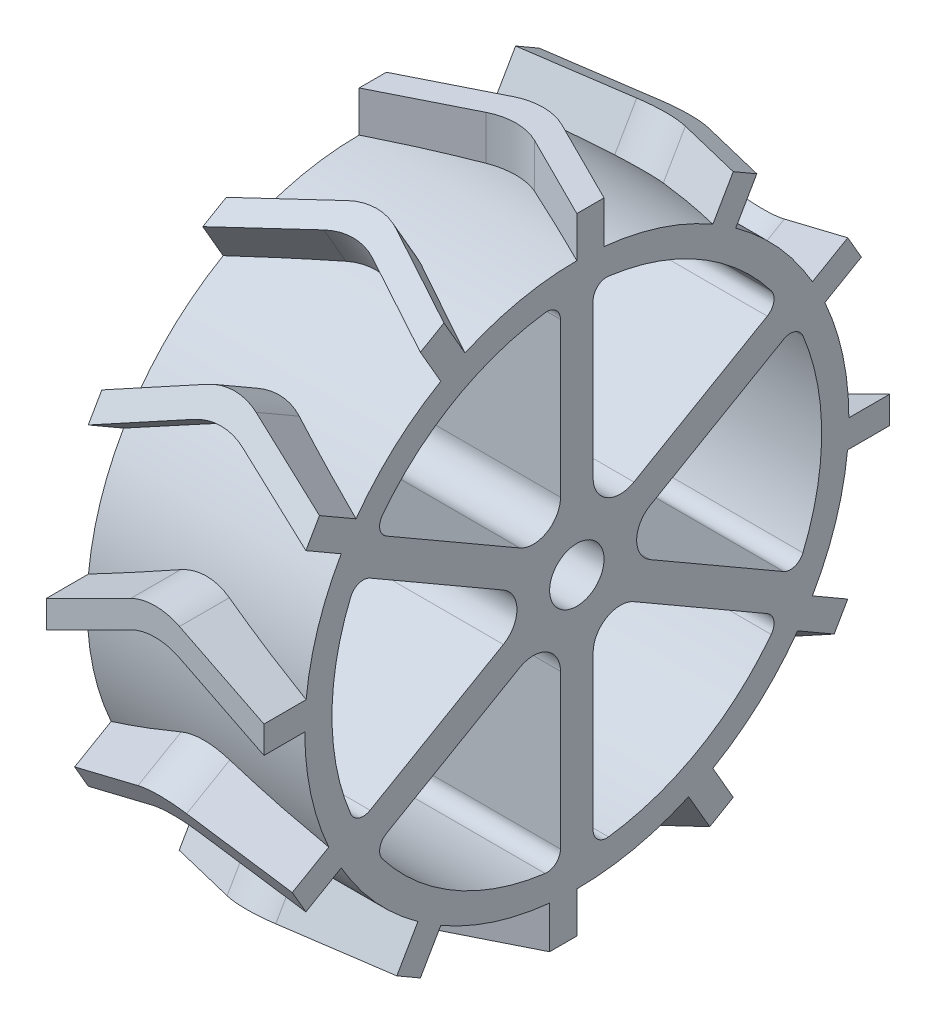
from build123d import *

# Parameters (mm, degrees)
SKETCH2_R                = 50
BOSS_EXTRUDE1_DEPTH      = 40
BOSS_EXTRUDE2_DEPTH      = 57.5
CIRPATTERN2_COUNT        = 12
CUT_EXTRUDE3_REACH       = 92.623
CUT_EXTRUDE4_REACH       = 92.623
SKETCH6_R                = 5
FILLET1_R                = 5
CIRPATTERN3_COUNT        = 6
FILLET1_OF_CIRPATTERN3_R = 5


with BuildPart() as part:
    # Sketch2 → Boss-Extrude1 (new body)
    with BuildSketch(Plane(origin=(0, 0, 0), x_dir=(0, 0, -1), z_dir=(1, 0, 0))):
        Circle(SKETCH2_R)
    extrude(amount=BOSS_EXTRUDE1_DEPTH)

    # Sketch4 → Boss-Extrude2 (add)
    with BuildSketch(Plane(origin=(0, 0, 0), x_dir=(1, 0, 0), z_dir=(0, 1, 0))):
        with BuildLine():
            Line((0, 0), (15.527864045, 7.763932023))
            ThreePointArc((15.527864045, 7.763932023), (20, 8.819660113), (24.472135955, 7.763932023))
            Line((24.472135955, 7.763932023), (40, 0))
            Line((40, 0), (40, 5))
            Line((40, 5), (24.472135955, 12.763932023))
            ThreePointArc((24.472135955, 12.763932023), (20, 13.819660113), (15.527864045, 12.763932023))
            Line((15.527864045, 12.763932023), (0, 5))
            Line((0, 5), (0, 0))
        make_face()
    boss_extrude2 = extrude(amount=BOSS_EXTRUDE2_DEPTH)

    # CirPattern2: Boss-Extrude2 ×12 about axis
    cirpattern2_axis = Axis((40, 0, 0), (-1, 0, 0))
    for i in range(1, CIRPATTERN2_COUNT):
        add(boss_extrude2.rotate(cirpattern2_axis, i * 360 / CIRPATTERN2_COUNT))

    # Sketch5 → Cut-Extrude3 (cut, up to next)
    with BuildSketch(Plane.ZY, mode=Mode.PRIVATE) as cut_extrude3_sk1:
        with BuildLine():
            Line((3, 42.142615011), (3, 5.196152423))
            Line((3, 5.196152423), (34.996575182, 23.669383717))
            ThreePointArc((34.996575182, 23.669383717), (36.198263903, 25.345343543), (35.73166784, 27.354120593))
            ThreePointArc((35.73166784, 27.354120593), (22.5, 38.97114317), (5.823529412, 44.621592365))
            ThreePointArc((5.823529412, 44.621592365), (3.850579424, 44.021287885), (3, 42.142615011))
        make_face()
    cut_extrude3_tool1 = extrude(cut_extrude3_sk1.sketch, amount=-CUT_EXTRUDE3_REACH, mode=Mode.PRIVATE) & part.part
    cut_extrude3 = cut_extrude3_tool1.solids().sort_by_distance((0, 26.780603, 15.461788))[0]
    add(cut_extrude3, mode=Mode.SUBTRACT)

    # Sketch6 → Cut-Extrude4 (cut, up to next)
    with BuildSketch(Plane.ZY, mode=Mode.PRIVATE) as cut_extrude4_sk1:
        Circle(SKETCH6_R)
    cut_extrude4_tool1 = extrude(cut_extrude4_sk1.sketch, amount=-CUT_EXTRUDE4_REACH, mode=Mode.PRIVATE) & part.part
    add(cut_extrude4_tool1.solids().sort_by_distance((0, 0, 0))[0], mode=Mode.SUBTRACT)

    # Fillet1
    fillet1_edges = [part.edges().sort_by_distance(p)[0] for p in [
        (20, 5.196152423, 3),
    ]]
    fillet(fillet1_edges, radius=FILLET1_R)

    # CirPattern3: Cut-Extrude3 ×6 about axis
    cirpattern3_axis = Axis((0, 0, 0), (1, 0, 0))
    for i in range(1, CIRPATTERN3_COUNT):
        add(cut_extrude3.rotate(cirpattern3_axis, i * 360 / CIRPATTERN3_COUNT), mode=Mode.SUBTRACT)

    # Fillet1 of CirPattern3
    fillet1_of_cirpattern3_edges = [part.edges().sort_by_distance(p)[0] for p in [
        (20, 0, 6),
        (20, -5.196152423, 3),
        (20, -5.196152423, -3),
        (20, 0, -6),
        (20, 5.196152423, -3),
    ]]
    fillet(fillet1_of_cirpattern3_edges, radius=FILLET1_OF_CIRPATTERN3_R)


solid = part.part
